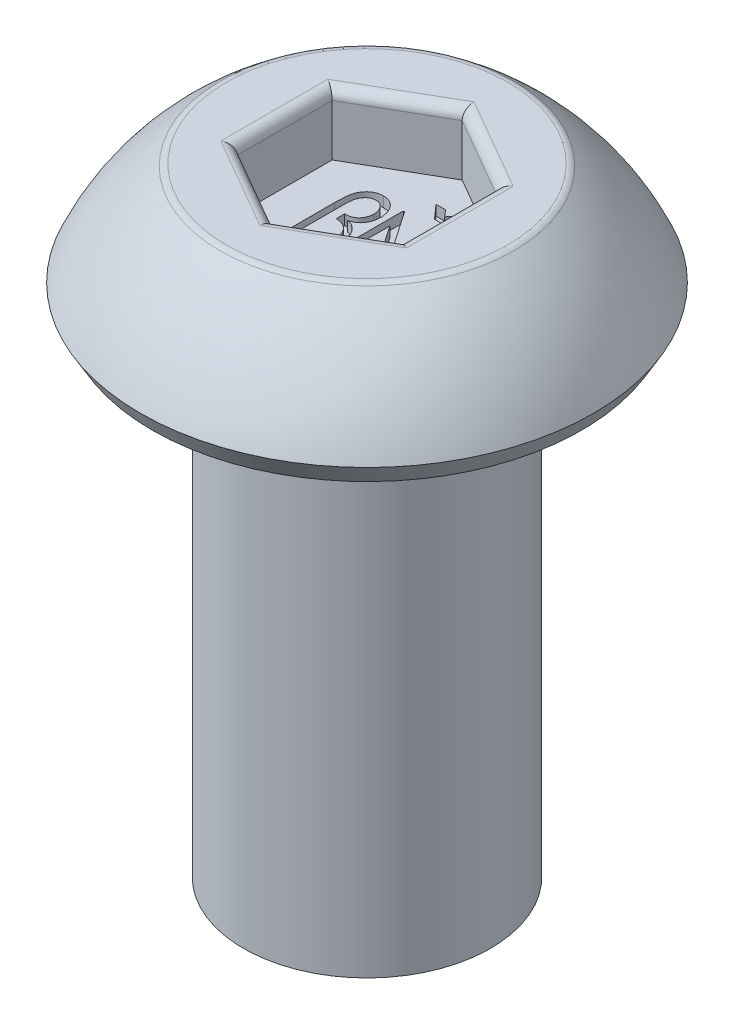
from build123d import *

# Parameters (mm, degrees)
CUT_EXTRUDE1_DEPTH = 0.75
FILLET1_R          = 0.125
WRAP1_START        = -0.125
WRAP1_DEPTH        = 0.125


# Read off the part's stored shape, not the designer's step: Wrap1
with BuildPart() as part:
    # Sketch1 → Revolve1 (revolve)
    with BuildSketch(Plane(origin=(0, 0, 0), x_dir=(0, 0, -1), z_dir=(1, 0, 0)), mode=Mode.PRIVATE) as revolve1_sk:
        with BuildLine():
            Line((0, 1.5), (-1.75, 1.5))
            ThreePointArc((-1.75, 1.5), (-2.334912942, 0.942930354), (-2.75, 0.25))
            Line((-2.75, 0.25), (-2.605662433, 0))
            Line((-2.605662433, 0), (-1.5, 0))
            Line((-1.5, 0), (-1.5, -6))
            Line((-1.5, -6), (0, -6))
            Line((0, -6), (0, 1.5))
        make_face()
    revolve(revolve1_sk.sketch.rotate(Axis((0, -6, 0), (0, 1, 0)), 180), axis=Axis((0, -6, 0), (0, 1, 0)))

    # Sketch2 → Cut-Extrude1 (cut)
    with BuildSketch(Plane(origin=(0, 1.5, 0), x_dir=(1, 0, 0), z_dir=(0, 1, 0))):
        Polygon((0, 1.154700538), (-1, 0.577350269), (-1, -0.577350269), (0, -1.154700538), (1, -0.577350269), (1, 0.577350269), align=None)
    extrude(amount=-CUT_EXTRUDE1_DEPTH, mode=Mode.SUBTRACT)

    # Fillet1
    fillet1_edges = [part.edges().sort_by_distance(p)[0] for p in [
        (0.5, 1.5, -0.866025404),
        (-0.5, 1.5, -0.866025404),
        (-1, 1.5, 0),
        (-0.5, 1.5, 0.866025404),
        (0.5, 1.5, 0.866025404),
        (1, 1.5, 0),
        (0, 1.5, 1.75),
    ]]
    fillet(fillet1_edges, radius=FILLET1_R)

    # Wrap1 outline → Wrap1 (cut)
    with BuildSketch(Plane(origin=(0, 0.75, 0), x_dir=(1, 0, 0), z_dir=(0, 1, 0)).offset(WRAP1_START)):
        with BuildLine():
            add(Edge.make_bspline(
                [(-0.537455829, 0.145072229), (-0.537366548, 0.15735919), (-0.537194747, 0.181002472), (-0.536236546, 0.215136123), (-0.534510696, 0.246473554), (-0.531857696, 0.275057496), (-0.528751002, 0.300937263), (-0.524861231, 0.324098842), (-0.520025531, 0.344486675), (-0.512963856, 0.367808475), (-0.501673714, 0.39403328), (-0.484042302, 0.422215735), (-0.462961845, 0.447719467), (-0.43819726, 0.469796385), (-0.410438674, 0.48826361), (-0.379753396, 0.501330341), (-0.346770262, 0.509472114), (-0.323962243, 0.510388658), (-0.312295573, 0.510857485)],
                knots=[0, 0, 0, 0, 0.075666503, 0.145601872, 0.210267314, 0.268902852, 0.322354979, 0.370758742, 0.413447068, 0.451298193, 0.520734923, 0.588514213, 0.655379256, 0.723813985, 0.792131248, 0.85973193, 0.928250616, 1, 1, 1, 1], degree=3))
            Line((-0.537455829, 0.145072229), (-0.537455829, -0.527604053))
            Line((-0.537455829, -0.527604053), (-0.460532752, -0.527604053))
            Line((-0.460532752, -0.527604053), (-0.460532752, 0.137460049))
            add(Edge.make_bspline(
                [(-0.447712239, 0.305328639), (-0.448774545, 0.301469619), (-0.451134212, 0.292897693), (-0.453525545, 0.278533298), (-0.455753975, 0.261566558), (-0.457491806, 0.241915402), (-0.458861613, 0.219538201), (-0.459832928, 0.194491685), (-0.460431178, 0.166843342), (-0.460497896, 0.147543183), (-0.460532752, 0.137460049)],
                knots=[0, 0, 0, 0, 0.071102967, 0.157938928, 0.258486703, 0.375288845, 0.508476997, 0.656953648, 0.820779591, 1, 1, 1, 1], degree=3))
            add(Edge.make_bspline(
                [(-0.310292367, 0.421113895), (-0.317674297, 0.420714803), (-0.332400851, 0.419918636), (-0.353965955, 0.413875353), (-0.374511474, 0.403804365), (-0.393760239, 0.390026559), (-0.411220155, 0.372905819), (-0.426330799, 0.352966004), (-0.438683838, 0.330213781), (-0.444651659, 0.313764569), (-0.447712239, 0.305328639)],
                knots=[0, 0, 0, 0, 0.115143072, 0.229704239, 0.346728965, 0.47082069, 0.597615275, 0.727089869, 0.860038825, 1, 1, 1, 1], degree=3))
            add(Edge.make_bspline(
                [(-0.17848147, 0.261057806), (-0.178952566, 0.271974178), (-0.179864172, 0.293098195), (-0.186637459, 0.323530756), (-0.198777604, 0.350930356), (-0.212261145, 0.371485038), (-0.225066026, 0.38586534), (-0.235235588, 0.395399384), (-0.246252738, 0.403200746), (-0.257654824, 0.410013084), (-0.269995595, 0.414921405), (-0.282862679, 0.418632696), (-0.296413152, 0.420560449), (-0.305613195, 0.420927309), (-0.310292367, 0.421113895)],
                knots=[0, 0, 0, 0, 0.141583044, 0.273974039, 0.401600231, 0.528456794, 0.591043942, 0.651122908, 0.708825408, 0.765880537, 0.822988251, 0.880580103, 0.939262648, 1, 1, 1, 1], degree=3))
            add(Edge.make_bspline(
                [(-0.340941406, 0.087780562), (-0.334988303, 0.08792105), (-0.323299062, 0.088196907), (-0.306225523, 0.090764835), (-0.289888322, 0.094368098), (-0.274654087, 0.100137271), (-0.260174408, 0.107124777), (-0.24682212, 0.11601785), (-0.234254323, 0.126336142), (-0.222711003, 0.138095802), (-0.212416341, 0.151054166), (-0.203323514, 0.164708223), (-0.195692258, 0.179095557), (-0.189162431, 0.194099224), (-0.184457799, 0.209936522), (-0.181072867, 0.226359939), (-0.178698712, 0.243427453), (-0.178554801, 0.255106579), (-0.17848147, 0.261057806)],
                knots=[0, 0, 0, 0, 0.067065692, 0.131687113, 0.194317921, 0.255289037, 0.314878218, 0.375218702, 0.435653028, 0.497934511, 0.56059698, 0.621980302, 0.682601877, 0.743985199, 0.806139168, 0.868443394, 0.932963888, 1, 1, 1, 1], degree=3))
            Line((-0.340941406, 0.087780562), (-0.357968649, 0.087780562))
            Line((-0.357968649, 0.087780562), (-0.357968649, -0.014783541))
            add(Edge.make_bspline(
                [(-0.152840444, -0.246153733), (-0.152991921, -0.237935238), (-0.153288163, -0.221862292), (-0.155672785, -0.198335348), (-0.159894598, -0.176034257), (-0.165736265, -0.154867378), (-0.173053307, -0.13483662), (-0.182215246, -0.116043494), (-0.192787882, -0.098300128), (-0.20519576, -0.081953022), (-0.21910276, -0.067000398), (-0.234429011, -0.053697294), (-0.25160782, -0.04265632), (-0.269991613, -0.033131715), (-0.29004854, -0.025867397), (-0.311286964, -0.019869429), (-0.334167811, -0.016416131), (-0.349879854, -0.015338382), (-0.357968649, -0.014783541)],
                knots=[0, 0, 0, 0, 0.070899124, 0.138657723, 0.203740428, 0.266496883, 0.327925022, 0.387445969, 0.44662859, 0.505853257, 0.564143059, 0.622569358, 0.680413321, 0.739931479, 0.800819634, 0.864131594, 0.930052902, 1, 1, 1, 1], degree=3))
            add(Edge.make_bspline(
                [(-0.309891726, -0.450680977), (-0.304334961, -0.450571211), (-0.293413044, -0.450355466), (-0.277514036, -0.447340483), (-0.262286727, -0.442989313), (-0.247781817, -0.436676481), (-0.233907442, -0.428733085), (-0.221051475, -0.418678171), (-0.208664071, -0.407189838), (-0.197187775, -0.393882067), (-0.186871623, -0.37903336), (-0.17755536, -0.363253667), (-0.169907305, -0.346235338), (-0.163848892, -0.328206631), (-0.158625475, -0.30926113), (-0.155449196, -0.289102842), (-0.15305503, -0.26797937), (-0.152912733, -0.253506267), (-0.152840444, -0.246153733)],
                knots=[0, 0, 0, 0, 0.057830355, 0.113666545, 0.168061557, 0.222616608, 0.278122197, 0.334218011, 0.392319921, 0.453992458, 0.516935927, 0.58055674, 0.644719566, 0.710965936, 0.778658745, 0.849251577, 0.923417744, 1, 1, 1, 1], degree=3))
            add(Edge.make_bspline(
                [(-0.409250701, -0.417427771), (-0.40035509, -0.422552084), (-0.383473121, -0.432276934), (-0.357561529, -0.44229785), (-0.333383308, -0.449497533), (-0.317482442, -0.450298576), (-0.309891726, -0.450680977)],
                knots=[0, 0, 0, 0, 0.290177362, 0.550694617, 0.785511707, 1, 1, 1, 1], degree=3))
            Line((-0.409250701, -0.417427771), (-0.409250701, -0.507371682))
            add(Edge.make_bspline(
                [(-0.298273137, -0.540424566), (-0.308861639, -0.540097242), (-0.329301798, -0.539465371), (-0.358664913, -0.532954409), (-0.385682425, -0.522833546), (-0.401463988, -0.512480121), (-0.409250701, -0.507371682)],
                knots=[0, 0, 0, 0, 0.269471748, 0.52019112, 0.763259579, 1, 1, 1, 1], degree=3))
            add(Edge.make_bspline(
                [(-0.075917367, -0.249759502), (-0.076128163, -0.26018073), (-0.076541077, -0.280594276), (-0.079227651, -0.310491914), (-0.084396107, -0.33890103), (-0.091033777, -0.365960134), (-0.09992887, -0.391457717), (-0.110563094, -0.41559927), (-0.123397597, -0.438155636), (-0.137962217, -0.459132621), (-0.153934421, -0.478163377), (-0.171095941, -0.494958486), (-0.189740067, -0.508821331), (-0.209271063, -0.520337979), (-0.2298646, -0.529505832), (-0.251686582, -0.535889962), (-0.274626983, -0.539804561), (-0.290311376, -0.540215808), (-0.298273137, -0.540424566)],
                knots=[0, 0, 0, 0, 0.076485505, 0.149823073, 0.219996399, 0.288217649, 0.354082023, 0.417919027, 0.481558234, 0.544225908, 0.605087621, 0.663657146, 0.720011753, 0.77514507, 0.829777395, 0.884976008, 0.941611157, 1, 1, 1, 1], degree=3))
            add(Edge.make_bspline(
                [(-0.194707432, 0.00885428), (-0.185532098, 0.002246917), (-0.167142487, -0.010995852), (-0.14356067, -0.035865532), (-0.123015599, -0.064046821), (-0.106173919, -0.095826321), (-0.092429948, -0.130510752), (-0.082995533, -0.168026939), (-0.077008082, -0.208034101), (-0.076287996, -0.23558107), (-0.075917367, -0.249759502)],
                knots=[0, 0, 0, 0, 0.114174048, 0.228832702, 0.344903554, 0.466103946, 0.591676048, 0.72144281, 0.856626542, 1, 1, 1, 1], degree=3))
            add(Edge.make_bspline(
                [(-0.273032752, 0.036899152), (-0.264977593, 0.035253476), (-0.249714467, 0.032135208), (-0.228666305, 0.025295577), (-0.210172583, 0.018341569), (-0.199638474, 0.011879289), (-0.194707432, 0.00885428)],
                knots=[0, 0, 0, 0, 0.294434237, 0.557901696, 0.79305271, 1, 1, 1, 1], degree=3))
            add(Edge.make_bspline(
                [(-0.200917367, 0.061939216), (-0.205600715, 0.059219735), (-0.215469689, 0.053489114), (-0.232413767, 0.046806913), (-0.251771921, 0.040993346), (-0.265723651, 0.038306664), (-0.273032752, 0.036899152)],
                knots=[0, 0, 0, 0, 0.211315364, 0.445293882, 0.709397831, 1, 1, 1, 1], degree=3))
            add(Edge.make_bspline(
                [(-0.101558393, 0.265064216), (-0.101829728, 0.254158186), (-0.102360461, 0.23282596), (-0.107582885, 0.201794643), (-0.115635878, 0.172523389), (-0.127393107, 0.145424978), (-0.141807851, 0.120566799), (-0.158666737, 0.09801557), (-0.178511599, 0.078390972), (-0.193428545, 0.067437991), (-0.200917367, 0.061939216)],
                knots=[0, 0, 0, 0, 0.138734507, 0.271365083, 0.399463796, 0.524371928, 0.64626696, 0.764603187, 0.881822663, 1, 1, 1, 1], degree=3))
            add(Edge.make_bspline(
                [(-0.312295573, 0.510857485), (-0.304601721, 0.510709635), (-0.289468193, 0.510418818), (-0.267407867, 0.506806308), (-0.246411552, 0.501505665), (-0.226632783, 0.49383833), (-0.208041676, 0.483900131), (-0.190537128, 0.47184286), (-0.174217748, 0.457507541), (-0.159329374, 0.44106616), (-0.145724285, 0.423136003), (-0.133914037, 0.403846519), (-0.123827558, 0.383480477), (-0.115525112, 0.361982783), (-0.109489008, 0.339238969), (-0.104721569, 0.315513437), (-0.102229905, 0.290624502), (-0.101784813, 0.273682609), (-0.101558393, 0.265064216)],
                knots=[0, 0, 0, 0, 0.063537388, 0.124975739, 0.184284437, 0.242302503, 0.299838056, 0.35817297, 0.417627897, 0.478966986, 0.541230446, 0.60342781, 0.66563497, 0.728883988, 0.793562004, 0.859921094, 0.928741429, 1, 1, 1, 1], degree=3))
        make_face()
        Polygon((0.565629107, -0.527604053), (0.583056992, -0.527604053), (0.583056992, 0.472395947), (0.506133915, 0.472395947), (0.506133915, -0.290224246), (-0.016101662, 0.472395947), (-0.032327624, 0.472395947), (-0.032327624, -0.527604053), (0.044595453, -0.527604053), (0.044595453, 0.233012934), align=None)
        Polygon((0.095877504, 0.741626716), (0.244315004, 0.574960049), (0.318633915, 0.574960049), (0.467672376, 0.741626716), (0.350885517, 0.741626716), (0.280172376, 0.662700434), (0.212664363, 0.741626716), align=None)
    extrude(amount=WRAP1_DEPTH, mode=Mode.SUBTRACT)


solid = part.part
